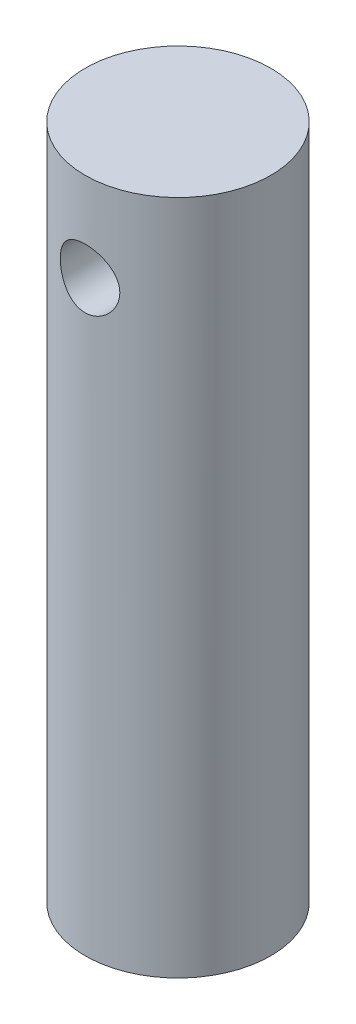
from build123d import *

# Parameters (mm, degrees)
BOSS_EXTRUDE1_DEPTH      = 6.35
SKETCH6_R                = 19.431
BOSS_EXTRUDE4_DEPTH      = 0.762
SKETCH7_R                = 19.05
BOSS_EXTRUDE5_DEPTH      = 68.326
FILLET6_R                = 5.08
FILLET7_R                = 1.905
BOSS_EXTRUDE15_DEPTH     = 6.35
SKETCH24_R               = 4.064
BOSS_EXTRUDE16_DEPTH     = 10.16
SKETCH25_R               = 2.54
BOSS_EXTRUDE17_DEPTH     = 10.16
BOSS_EXTRUDE19_DEPTH     = 16.51
FILLET13_R               = 1.905
FILLET14_R               = 5.08
BOSS_EXTRUDE20_DEPTH     = 18.796
CHAMFER1_SIZE            = 2.54
FILLET15_R               = 2.54
CHAMFER2_SIZE            = 0.762
SKETCH27_R               = 3.175
CUT_EXTRUDE3_DEPTH       = 19.05
SKETCH28_R               = 19.05
BOSS_EXTRUDE22_DEPTH     = 1.27
SKETCH29_R               = 19.05
BOSS_EXTRUDE24_DEPTH     = 3.048
BOSS_EXTRUDE25_START     = 4.318
SKETCH8_R                = 4.953
BOSS_EXTRUDE25_DEPTH     = 1.27
FILLET16_R               = 0.2286
BOSS_EXTRUDE26_DEPTH     = 254.381
BOSS_EXTRUDE27_DEPTH     = 8.89
SKETCH33_R               = 9.906
BOSS_EXTRUDE28_DEPTH     = 21.336
BOSS_EXTRUDE30_DEPTH     = 2.159
BOSS_EXTRUDE31_DEPTH     = 2.159
BOSS_EXTRUDE33_DEPTH     = 12.7
BOSS_EXTRUDE33_2_DEPTH   = 12.7
FILLET17_R               = 0.2286
FILLET18_R               = 0.2286
SKETCH43_R               = 3.175
BOSS_EXTRUDE34_DEPTH     = 1.27
FILLET19_R               = 1.27
SKETCH44_R               = 3.175
BOSS_EXTRUDE35_DEPTH     = 1.27
FILLET20_R               = 1.27
CUT_EXTRUDE5_START       = -2.54
CUT_EXTRUDE5_DEPTH       = 2.54
CUT_EXTRUDE6_START       = -2.54
CUT_EXTRUDE6_DEPTH       = 2.54
SKETCH47_R               = 2.54
BOSS_EXTRUDE36_DEPTH     = 2.54
BOSS_EXTRUDE36_2_DEPTH   = 2.54
BOSS_EXTRUDE36_3_DEPTH   = 2.54
FILLET22_R               = 1.524
FILLET23_R               = 1.524
SKETCH48_R               = 3.81
BOSS_EXTRUDE37_DEPTH     = 1.524
FILLET24_R               = 1.524
FILLET25_R               = 1.524
SKETCH49_R               = 3.81
CUT_EXTRUDE7_DEPTH       = 2.54
SKETCH50_R               = 3.556
BOSS_EXTRUDE39_DEPTH     = 2.54
CUT_EXTRUDE11_DEPTH      = 305.554552522
CUT_EXTRUDE11_DEPTH_BACK = 305.554552522
SKETCH52_R               = 3.175
SKETCH55_W               = 170.584012947
SKETCH55_H               = 114.953192418
CUT_EXTRUDE13_DEPTH      = 346.202
SKETCH56_R               = 9.906
BOSS_EXTRUDE40_DEPTH     = 50.8


with BuildPart() as part:
    # Sketch1 → Boss-Extrude1 (new body)
    with BuildSketch(Plane(origin=(0, 0, 0), x_dir=(1, 0, 0), z_dir=(0, 1, 0))):
        with BuildLine():
            Line((0, 32.639), (7.239, 39.878))
            Line((7.239, 39.878), (55.118, 39.878))
            ThreePointArc((55.118, 39.878), (75.057, 19.939), (55.118, 0))
            Line((55.118, 0), (7.239, 0))
            Line((7.239, 0), (0, 7.239))
            Line((0, 7.239), (0, 32.639))
        make_face()
    extrude(amount=BOSS_EXTRUDE1_DEPTH)

    # Fillet6
    fillet6_edges = [part.edges().sort_by_distance(p)[0] for p in [
        (0, 3.175, -7.239),
        (0, 3.175, -32.639),
    ]]
    fillet(fillet6_edges, radius=FILLET6_R)

    # Fillet7
    fillet7_edges = [part.edges().sort_by_distance(p)[0] for p in [
        (7.239, 3.175, 0),
        (7.239, 3.175, -39.878),
    ]]
    fillet(fillet7_edges, radius=FILLET7_R)


with BuildPart() as body_2:
    # Sketch6 → Boss-Extrude4 (new body)
    with BuildSketch(Plane(origin=(0, 6.35, 0), x_dir=(1, 0, 0), z_dir=(0, 1, 0))):
        with Locations(Location((55.118, 19.939, 0), (0, 0, 90))):
            Circle(SKETCH6_R)
    extrude(amount=BOSS_EXTRUDE4_DEPTH)


with BuildPart() as body_3:
    # Sketch7 → Boss-Extrude5 (new body)
    with BuildSketch(Plane(origin=(0, 7.112, 0), x_dir=(1, 0, 0), z_dir=(0, 1, 0))):
        with Locations(Location((55.118, 19.939, 0), (0, 0, 270))):
            Circle(SKETCH7_R)
    extrude(amount=BOSS_EXTRUDE5_DEPTH)


with BuildPart() as body_4:
    # Sketch23 → Boss-Extrude15 (new body)
    with BuildSketch(Plane(origin=(12.522748088, 0, -46.735532116), x_dir=(0, -1, 0), z_dir=(0.25881904510252135, 0, -0.9659258262890681))):
        with BuildLine():
            Line((-2.032, -53.883866243), (5.588, -53.883866243))
            ThreePointArc((5.588, -53.883866243), (11.303, -48.168866243), (5.588, -42.453866243))
            Line((5.588, -42.453866243), (-2.032, -42.453866243))
            Line((-2.032, -42.453866243), (-2.032, -53.883866243))
        make_face()
    extrude(amount=BOSS_EXTRUDE15_DEPTH)

    # Sketch24 → Boss-Extrude16 (add)
    with BuildSketch(Plane(origin=(14.166249025, 0, -52.869161113), x_dir=(-0.9659258262890682, 0, -0.25881904510252135), z_dir=(0.2588190451025213, 0, -0.9659258262890681))):
        with Locations((-48.168866243, -5.588)):
            Circle(SKETCH24_R)
    extrude(amount=BOSS_EXTRUDE16_DEPTH)

    # Sketch25 → Boss-Extrude17 (add)
    with BuildSketch(Plane(origin=(16.795850523, 0, -62.682967508), x_dir=(-0.9659258262890681, 0, -0.25881904510252135), z_dir=(0.25881904510252135, 0, -0.9659258262890681))):
        with Locations((-48.168866243, -5.588)):
            Circle(SKETCH25_R)
    extrude(amount=BOSS_EXTRUDE17_DEPTH)


with BuildPart() as body_5:
    # Sketch1<3> → Boss-Extrude19 (new body)
    with BuildSketch(Plane(origin=(0, 0, 0), x_dir=(1, 0, 0), z_dir=(0, 1, 0))):
        with BuildLine():
            Line((0, 32.639), (7.239, 39.878))
            Line((7.239, 39.878), (55.118, 39.878))
            ThreePointArc((55.118, 39.878), (75.057, 19.939), (55.118, 0))
            Line((55.118, 0), (7.239, 0))
            Line((7.239, 0), (0, 7.239))
            Line((0, 7.239), (0, 32.639))
        make_face()
    extrude(amount=-BOSS_EXTRUDE19_DEPTH)

    # Fillet13
    fillet13_edges = [body_5.edges().sort_by_distance(p)[0] for p in [
        (7.239, -8.255, 0),
        (7.239, -8.255, -39.878),
    ]]
    fillet(fillet13_edges, radius=FILLET13_R)

    # Fillet14
    fillet14_edges = [body_5.edges().sort_by_distance(p)[0] for p in [
        (0, -8.255, -7.239),
        (0, -8.255, -32.639),
    ]]
    fillet(fillet14_edges, radius=FILLET14_R)

    # Sketch45 → Cut-Extrude5 (cut)
    with BuildSketch(Plane.XZ.offset(16.51).offset(CUT_EXTRUDE5_START)):
        with BuildLine():
            ThreePointArc((5.044290367, -35.978344089), (4.718699387, -36.549691761), (4.084467985, -36.723467985))
            Line((4.084467985, -36.723467985), (6.681038418, -39.320038418))
            ThreePointArc((6.681038418, -39.320038418), (7.299064898, -39.732990509), (8.028076836, -39.878))
            Line((8.028076836, -39.878), (11.393838428, -39.878))
            ThreePointArc((11.393838428, -39.878), (11.138454644, -39.419455597), (11.282110896, -38.914632134))
            ThreePointArc((11.282110896, -38.914632134), (10.476958507, -32.531164357), (5.044290367, -35.978344089))
        make_face()
        with BuildLine():
            ThreePointArc((11.282110896, -0.963367866), (11.138454644, -0.458544403), (11.393838428, 0))
            Line((11.393838428, 0), (8.028076836, 0))
            ThreePointArc((8.028076836, 0), (7.299064898, -0.145009491), (6.681038418, -0.557961582))
            Line((6.681038418, -0.557961582), (4.084467985, -3.154532015))
            ThreePointArc((4.084467985, -3.154532015), (4.718699387, -3.328308239), (5.044290367, -3.899655911))
            ThreePointArc((5.044290367, -3.899655911), (10.476958507, -7.346835643), (11.282110896, -0.963367866))
        make_face()
    extrude(amount=CUT_EXTRUDE5_DEPTH, mode=Mode.SUBTRACT)

    # Sketch45<3> → Cut-Extrude6 (cut)
    with BuildSketch(Plane.XZ.offset(16.51).offset(CUT_EXTRUDE6_START)):
        with BuildLine():
            Line((4.084467985, -36.723467985), (6.681038418, -39.320038418))
            ThreePointArc((6.681038418, -39.320038418), (7.299064898, -39.732990509), (8.028076836, -39.878))
            Line((8.028076836, -39.878), (11.393838428, -39.878))
            ThreePointArc((11.393838428, -39.878), (11.138454644, -39.419455597), (11.282110896, -38.914632134))
            ThreePointArc((11.282110896, -38.914632134), (10.476958507, -32.531164357), (5.044290367, -35.978344089))
            ThreePointArc((5.044290367, -35.978344089), (4.718699387, -36.549691761), (4.084467985, -36.723467985))
        make_face()
        with BuildLine():
            Line((11.393838428, 0), (8.028076836, 0))
            ThreePointArc((8.028076836, 0), (7.299064898, -0.145009491), (6.681038418, -0.557961582))
            Line((6.681038418, -0.557961582), (4.084467985, -3.154532015))
            ThreePointArc((4.084467985, -3.154532015), (4.718699387, -3.328308239), (5.044290367, -3.899655911))
            ThreePointArc((5.044290367, -3.899655911), (10.476958507, -7.346835643), (11.282110896, -0.963367866))
            ThreePointArc((11.282110896, -0.963367866), (11.138454644, -0.458544403), (11.393838428, 0))
        make_face()
        with BuildLine():
            ThreePointArc((73.662109712, -16.992248385), (67.437, -19.939), (73.662109712, -22.885751615))
            ThreePointArc((73.662109712, -22.885751615), (74.341584064, -23.041280193), (74.712069674, -23.631716426))
            ThreePointArc((74.712069674, -23.631716426), (75.057, -19.939), (74.712069674, -16.246283574))
            ThreePointArc((74.712069674, -16.246283574), (74.341584064, -16.836719807), (73.662109712, -16.992248385))
        make_face()
    extrude(amount=CUT_EXTRUDE6_DEPTH, mode=Mode.SUBTRACT)


with BuildPart() as body_6:
    # Sketch26 → Boss-Extrude20 (new body)
    with BuildSketch(Plane(origin=(0, -16.51, 0), x_dir=(-1, 0, 0), z_dir=(0, -1, 0))):
        Polygon((-20.574, 28.829), (-11.684, 28.829), (-11.684, 11.049), (-29.464, 11.049), (-29.464, 28.829), align=None)
    extrude(amount=BOSS_EXTRUDE20_DEPTH)

    # Chamfer1
    chamfer1_edges = [body_6.edges().sort_by_distance(p)[0] for p in [
        (11.684, -25.908, -11.049),
        (29.464, -25.908, -11.049),
        (29.464, -25.908, -28.829),
        (11.684, -25.908, -28.829),
    ]]
    chamfer(chamfer1_edges, length=CHAMFER1_SIZE)

    # Fillet15
    fillet15_edges = [body_6.edges().sort_by_distance(p)[0] for p in [
        (29.464, -25.908, -13.589),
        (29.464, -25.908, -26.289),
        (14.224, -25.908, -28.829),
        (26.924, -25.908, -28.829),
        (14.224, -25.908, -11.049),
        (26.924, -25.908, -11.049),
        (11.684, -25.908, -26.289),
        (11.684, -25.908, -13.589),
    ]]
    fillet(fillet15_edges, radius=FILLET15_R)

    # Chamfer2
    chamfer2_edges = [body_6.edges().sort_by_distance(p)[0] for p in [
        (11.684, -35.306, -19.939),
        (12.954, -35.306, -12.319),
        (20.574, -35.306, -28.829),
        (28.194, -35.306, -27.559),
        (29.464, -35.306, -19.939),
        (28.194, -35.306, -12.319),
        (20.574, -35.306, -11.049),
        (12.954, -35.306, -27.559),
        (14.30408653, -35.306, -28.635654013),
        (11.877345987, -35.306, -26.20891347),
        (26.84391347, -35.306, -28.635654013),
        (29.270654013, -35.306, -26.20891347),
        (29.270654013, -35.306, -13.66908653),
        (26.84391347, -35.306, -11.242345987),
        (14.30408653, -35.306, -11.242345987),
        (11.877345987, -35.306, -13.66908653),
    ]]
    chamfer(chamfer2_edges, length=CHAMFER2_SIZE)

    # Sketch27 → Cut-Extrude3 (cut)
    with BuildSketch(Plane.XY.offset(-11.049)):
        with Locations((20.574, -26.67)):
            Circle(SKETCH27_R)
    extrude(amount=-CUT_EXTRUDE3_DEPTH, mode=Mode.SUBTRACT)


with BuildPart() as body_7:
    # Sketch28 → Boss-Extrude22 (new body)
    with BuildSketch(Plane(origin=(0, 75.438, 0), x_dir=(1, 0, 0), z_dir=(0, 1, 0))):
        with Locations(Location((55.118, 19.939, 0), (0, 0, 270))):
            Circle(SKETCH28_R)
    extrude(amount=BOSS_EXTRUDE22_DEPTH)


with BuildPart() as body_8:
    # Sketch29 → Boss-Extrude24 (new body)
    with BuildSketch(Plane(origin=(0, 76.708, 0), x_dir=(1, 0, 0), z_dir=(0, 1, 0))):
        with Locations(Location((55.118, 19.939, 0), (0, 0, 270))):
            Circle(SKETCH29_R)
    extrude(amount=BOSS_EXTRUDE24_DEPTH)

    # Sketch8 → Boss-Extrude25 (add)
    with BuildSketch(Plane(origin=(0, 75.438, 0), x_dir=(1, 0, 0), z_dir=(0, 1, 0)).offset(BOSS_EXTRUDE25_START)):
        with Locations(Location((55.118, 19.939, 0), (0, 0, 270))):
            Circle(SKETCH8_R)
    extrude(amount=BOSS_EXTRUDE25_DEPTH)

    # Fillet16
    fillet16_edges = [body_8.edges().sort_by_distance(p)[0] for p in [
        (55.118, 81.026, -24.892),
    ]]
    fillet(fillet16_edges, radius=FILLET16_R)


with BuildPart() as body_9:
    # Sketch15 → Boss-Extrude26 (new body)
    with BuildSketch(Plane(origin=(0, 6.35, 0), x_dir=(1, 0, 0), z_dir=(0, 1, 0))):
        with BuildLine():
            Line((0, 19.939), (0, 10.286870396))
            Line((0, 10.286870396), (16.411980417, 5.54225678))
            ThreePointArc((16.411980417, 5.54225678), (35.560281138, 19.939054609), (16.411875495, 34.335712887))
            Line((16.411875495, 34.335712887), (0, 29.591))
            Line((0, 29.591), (0, 19.939))
        make_face()
    extrude(amount=BOSS_EXTRUDE26_DEPTH)

    # Sketch48 → Boss-Extrude37 (add)
    with BuildSketch(Plane.ZY):
        with Locations(Location((-19.939, 12.7, 0), (0, 0, 180))):
            Circle(SKETCH48_R)
    extrude(amount=BOSS_EXTRUDE37_DEPTH)

    # Fillet24
    fillet24_edges = [body_9.edges().sort_by_distance(p)[0] for p in [
        (-1.524, 12.7, -16.129),
    ]]
    fillet(fillet24_edges, radius=FILLET24_R - 0.0001)  # a hair under: the kernel refuses the full size

    # Sketch49 → Cut-Extrude7 (cut)
    with BuildSketch(Plane.ZY):
        with Locations((-19.938935198, 255.778)):
            Circle(SKETCH49_R)
    extrude(amount=-CUT_EXTRUDE7_DEPTH, mode=Mode.SUBTRACT)

    # Sketch50 → Boss-Extrude39 (add)
    with BuildSketch(Plane.ZY.offset(-2.54)):
        with Locations((-19.938935198, 255.778)):
            Circle(SKETCH50_R)
    extrude(amount=BOSS_EXTRUDE39_DEPTH)


with BuildPart() as body_10:
    # Sketch32 → Boss-Extrude27 (new body)
    with BuildSketch(Plane(origin=(0, 260.731, 0), x_dir=(1, 0, 0), z_dir=(0, 1, 0))):
        with BuildLine():
            Line((0, 10.286870396), (0, 29.591))
            Line((0, 29.591), (16.411875495, 34.335712887))
            ThreePointArc((16.411875495, 34.335712887), (35.560281138, 19.939054609), (16.411980417, 5.54225678))
            Line((16.411980417, 5.54225678), (0, 10.286870396))
        make_face()
    extrude(amount=BOSS_EXTRUDE27_DEPTH)

    # Sketch33 → Boss-Extrude28 (add)
    with BuildSketch(Plane(origin=(0, 269.621, 0), x_dir=(1, 0, 0), z_dir=(0, 1, 0))):
        with Locations(Location((20.574, 19.939, 0), (0, 0, 270))):
            Circle(SKETCH33_R)
    extrude(amount=BOSS_EXTRUDE28_DEPTH)

    # Sketch52 → Cut-Extrude11 (cut, two sides: drawn at the far end of the back side and taken through both)
    with BuildSketch(Plane.XY.offset(-11.049).offset(-CUT_EXTRUDE11_DEPTH_BACK)):
        with Locations(Location((20.574, 281.432, 0), (0, 0, 89.99999999))):
            Circle(SKETCH52_R)
    extrude(amount=CUT_EXTRUDE11_DEPTH + CUT_EXTRUDE11_DEPTH_BACK, mode=Mode.SUBTRACT)


with BuildPart() as body_11:
    # Sketch41 → Boss-Extrude30 (new body)
    with BuildSketch(Plane(origin=(0, 6.35, 0), x_dir=(1, 0, 0), z_dir=(0, 1, 0))):
        with BuildLine():
            Line((0, 29.591), (16.411875495, 34.335712887))
            ThreePointArc((16.411875495, 34.335712887), (22.021175201, 34.855243035), (27.425990452, 33.267122493))
            Line((27.425990452, 33.267122493), (29.11221422, 34.953346261))
            ThreePointArc((29.11221422, 34.953346261), (22.604273469, 37.091541659), (15.776987058, 36.531780434))
            Line((15.776987058, 36.531780434), (0.2736806, 32.049737053))
            Line((0.2736806, 32.049737053), (0, 30.534795103))
            Line((0, 30.534795103), (0, 29.591))
        make_face()
    extrude(amount=BOSS_EXTRUDE30_DEPTH)


with BuildPart() as body_12:
    # Sketch41<11> → Boss-Extrude31 (new body)
    with BuildSketch(Plane(origin=(0, 6.35, 0), x_dir=(1, 0, 0), z_dir=(0, 1, 0))):
        with BuildLine():
            Line((16.411875495, 5.542157508), (0, 10.286870396))
            Line((0, 10.286870396), (0, 9.343204897))
            Line((0, 9.343204897), (0, 9.343075292))
            Line((0, 9.343075292), (0.2736806, 7.828133343))
            Line((0.2736806, 7.828133343), (15.776987058, 3.346089961))
            ThreePointArc((15.776987058, 3.346089961), (22.604273469, 2.786328737), (29.11221422, 4.924524135))
            Line((29.11221422, 4.924524135), (27.425990452, 6.610747903))
            ThreePointArc((27.425990452, 6.610747903), (22.021175201, 5.02262736), (16.411875495, 5.542157508))
        make_face()
    extrude(amount=BOSS_EXTRUDE31_DEPTH)


with BuildPart() as body_13:
    # Sketch41<12> → Boss-Extrude33 (new body)
    with BuildSketch(Plane(origin=(0, 6.35, 0), x_dir=(1, 0, 0), z_dir=(0, 1, 0))):
        with BuildLine():
            Line((29.11221422, 34.953346261), (27.425990452, 33.267122493))
            ThreePointArc((27.425990452, 33.267122493), (31.070982239, 30.634886416), (33.77116823, 27.039941701))
            Line((33.77116823, 27.039941701), (37.542875801, 30.811649272))
            Line((37.542875801, 30.811649272), (31.256696516, 37.097828557))
            Line((31.256696516, 37.097828557), (29.11221422, 34.953346261))
        make_face()
    extrude(amount=BOSS_EXTRUDE33_DEPTH)

    # Fillet17
    fillet17_edges = [body_13.edges().sort_by_distance(p)[0] for p in [
        (35.657022016, 19.05, -28.925795487),
        (34.399786159, 19.05, -33.954738915),
        (29.341343484, 19.05, -35.182475525),
        (31.256696516, 12.7, -37.097828557),
        (37.542875801, 12.7, -30.811649272),
    ]]
    fillet(fillet17_edges, radius=FILLET17_R)


with BuildPart() as body_14:
    # Sketch41<12> → Boss-Extrude33 2 (new body)
    with BuildSketch(Plane(origin=(0, 6.35, 0), x_dir=(1, 0, 0), z_dir=(0, 1, 0))):
        with BuildLine():
            Line((31.256696516, 2.780041839), (37.542875801, 9.066221123))
            Line((37.542875801, 9.066221123), (33.77116823, 12.837928694))
            ThreePointArc((33.77116823, 12.837928694), (31.070982239, 9.24298398), (27.425990452, 6.610747903))
            Line((27.425990452, 6.610747903), (29.11221422, 4.924524135))
            Line((29.11221422, 4.924524135), (31.256696516, 2.780041839))
        make_face()
    extrude(amount=BOSS_EXTRUDE33_2_DEPTH)

    # Fillet18
    fillet18_edges = [body_14.edges().sort_by_distance(p)[0] for p in [
        (34.399786159, 19.05, -5.923131481),
        (35.657022016, 19.05, -10.952074909),
        (29.341343484, 19.05, -4.695394871),
        (37.542875801, 12.7, -9.066221123),
        (31.256696516, 12.7, -2.780041839),
    ]]
    fillet(fillet18_edges, radius=FILLET18_R)


with BuildPart() as body_15:
    # Sketch43 → Boss-Extrude34 (new body)
    with BuildSketch(Plane(origin=(34.177262537, 0, -34.177262537), x_dir=(-0.7071067811865481, 0, -0.7071067811865469), z_dir=(0.7071067811865469, 0, -0.7071067811865481))):
        with Locations(Location((-0.314695924, 13.7414, 0), (0, 0, 180))):
            Circle(SKETCH43_R)
    extrude(amount=BOSS_EXTRUDE34_DEPTH)

    # Fillet19
    fillet19_edges = [body_15.edges().sort_by_distance(p)[0] for p in [
        (33.052747741, 13.7414, -37.097828557),
    ]]
    fillet(fillet19_edges, radius=FILLET19_R - 0.0001)  # a hair under: the kernel refuses the full size


with BuildPart() as body_16:
    # Sketch44 → Boss-Extrude35 (new body)
    with BuildSketch(Plane(origin=(14.238327339, 0, 14.238327339), x_dir=(0.7071067811865481, 0, -0.7071067811865469), z_dir=(0.7071067811865469, 0, 0.7071067811865481))):
        with Locations(Location((28.5126085, 13.7414, 0), (0, 0, 180))):
            Circle(SKETCH44_R)
    extrude(amount=BOSS_EXTRUDE35_DEPTH)

    # Fillet20
    fillet20_edges = [body_16.edges().sort_by_distance(p)[0] for p in [
        (37.542875801, 13.7414, -7.270169899),
    ]]
    fillet(fillet20_edges, radius=FILLET20_R - 0.0001)  # a hair under: the kernel refuses the full size


with BuildPart() as body_17:
    # Sketch47 → Boss-Extrude36 (new body)
    with BuildSketch(Plane(origin=(0, -13.97, 0), x_dir=(-1, 0, 0), z_dir=(0, -1, 0))):
        with Locations(Location((-8.854290367, 35.978344089, 0), (0, 0, 90))):
            Circle(SKETCH47_R)
    extrude(amount=BOSS_EXTRUDE36_DEPTH)

    # Fillet22
    fillet22_edges = [body_17.edges().sort_by_distance(p)[0] for p in [
        (8.854290367, -16.51, -33.438344089),
    ]]
    fillet(fillet22_edges, radius=FILLET22_R)


with BuildPart() as body_18:
    # Sketch47 → Boss-Extrude36 2 (new body)
    with BuildSketch(Plane(origin=(0, -13.97, 0), x_dir=(-1, 0, 0), z_dir=(0, -1, 0))):
        with Locations(Location((-8.854290367, 3.899655911, 0), (0, 0, 90))):
            Circle(SKETCH47_R)
    extrude(amount=BOSS_EXTRUDE36_2_DEPTH)

    # Fillet23
    fillet23_edges = [body_18.edges().sort_by_distance(p)[0] for p in [
        (8.854290367, -16.51, -1.359655911),
    ]]
    fillet(fillet23_edges, radius=FILLET23_R)


with BuildPart() as body_19:
    # Sketch47 → Boss-Extrude36 3 (new body)
    with BuildSketch(Plane(origin=(0, -13.97, 0), x_dir=(-1, 0, 0), z_dir=(0, -1, 0))):
        with Locations(Location((-71.247, 19.939, 0), (0, 0, 90))):
            Circle(SKETCH47_R)
    extrude(amount=BOSS_EXTRUDE36_3_DEPTH)

    # Fillet25
    fillet25_edges = [body_19.edges().sort_by_distance(p)[0] for p in [
        (71.247, -16.51, -17.399),
    ]]
    fillet(fillet25_edges, radius=FILLET25_R)


with BuildPart() as cut_extrude13_tool:
    # Sketch55 → Cut-Extrude13 (new body)
    with BuildSketch(Plane(origin=(0, 269.621, 0), x_dir=(1, 0, 0), z_dir=(0, 1, 0))):
        with Locations((34.605125539, 14.00827457)):
            Rectangle(SKETCH55_W, SKETCH55_H)
    extrude(amount=-CUT_EXTRUDE13_DEPTH)


with BuildPart() as part_1:
    add(part.part)

    # Cut-Extrude13: cut by cut_extrude13_tool
    add(cut_extrude13_tool.part, mode=Mode.SUBTRACT)


with BuildPart() as body_2_1:
    add(body_2.part)

    # Cut-Extrude13: cut by cut_extrude13_tool
    add(cut_extrude13_tool.part, mode=Mode.SUBTRACT)


with BuildPart() as body_3_1:
    add(body_3.part)

    # Cut-Extrude13: cut by cut_extrude13_tool
    add(cut_extrude13_tool.part, mode=Mode.SUBTRACT)


with BuildPart() as body_4_1:
    add(body_4.part)

    # Cut-Extrude13: cut by cut_extrude13_tool
    add(cut_extrude13_tool.part, mode=Mode.SUBTRACT)


with BuildPart() as body_5_1:
    add(body_5.part)

    # Cut-Extrude13: cut by cut_extrude13_tool
    add(cut_extrude13_tool.part, mode=Mode.SUBTRACT)


with BuildPart() as body_6_1:
    add(body_6.part)

    # Cut-Extrude13: cut by cut_extrude13_tool
    add(cut_extrude13_tool.part, mode=Mode.SUBTRACT)


with BuildPart() as body_7_1:
    add(body_7.part)

    # Cut-Extrude13: cut by cut_extrude13_tool
    add(cut_extrude13_tool.part, mode=Mode.SUBTRACT)


with BuildPart() as body_8_1:
    add(body_8.part)

    # Cut-Extrude13: cut by cut_extrude13_tool
    add(cut_extrude13_tool.part, mode=Mode.SUBTRACT)


with BuildPart() as body_9_1:
    add(body_9.part)

    # Cut-Extrude13: cut by cut_extrude13_tool
    add(cut_extrude13_tool.part, mode=Mode.SUBTRACT)


with BuildPart() as body_10_1:
    add(body_10.part)

    # Cut-Extrude13: cut by cut_extrude13_tool
    add(cut_extrude13_tool.part, mode=Mode.SUBTRACT)

    # Sketch56 → Boss-Extrude40 (add)
    with BuildSketch(Plane.XZ.offset(-269.621)):
        with Locations(Location((20.574, -19.939, 0), (0, 0, 270))):
            Circle(SKETCH56_R)
    extrude(amount=BOSS_EXTRUDE40_DEPTH)


with BuildPart() as body_11_1:
    add(body_11.part)

    # Cut-Extrude13: cut by cut_extrude13_tool
    add(cut_extrude13_tool.part, mode=Mode.SUBTRACT)


with BuildPart() as body_12_1:
    add(body_12.part)

    # Cut-Extrude13: cut by cut_extrude13_tool
    add(cut_extrude13_tool.part, mode=Mode.SUBTRACT)


with BuildPart() as body_13_1:
    add(body_13.part)

    # Cut-Extrude13: cut by cut_extrude13_tool
    add(cut_extrude13_tool.part, mode=Mode.SUBTRACT)


with BuildPart() as body_14_1:
    add(body_14.part)

    # Cut-Extrude13: cut by cut_extrude13_tool
    add(cut_extrude13_tool.part, mode=Mode.SUBTRACT)


with BuildPart() as body_15_1:
    add(body_15.part)

    # Cut-Extrude13: cut by cut_extrude13_tool
    add(cut_extrude13_tool.part, mode=Mode.SUBTRACT)


with BuildPart() as body_16_1:
    add(body_16.part)

    # Cut-Extrude13: cut by cut_extrude13_tool
    add(cut_extrude13_tool.part, mode=Mode.SUBTRACT)


with BuildPart() as body_17_1:
    add(body_17.part)

    # Cut-Extrude13: cut by cut_extrude13_tool
    add(cut_extrude13_tool.part, mode=Mode.SUBTRACT)


with BuildPart() as body_18_1:
    add(body_18.part)

    # Cut-Extrude13: cut by cut_extrude13_tool
    add(cut_extrude13_tool.part, mode=Mode.SUBTRACT)


with BuildPart() as body_19_1:
    add(body_19.part)

    # Cut-Extrude13: cut by cut_extrude13_tool
    add(cut_extrude13_tool.part, mode=Mode.SUBTRACT)


solid = body_10_1.part
